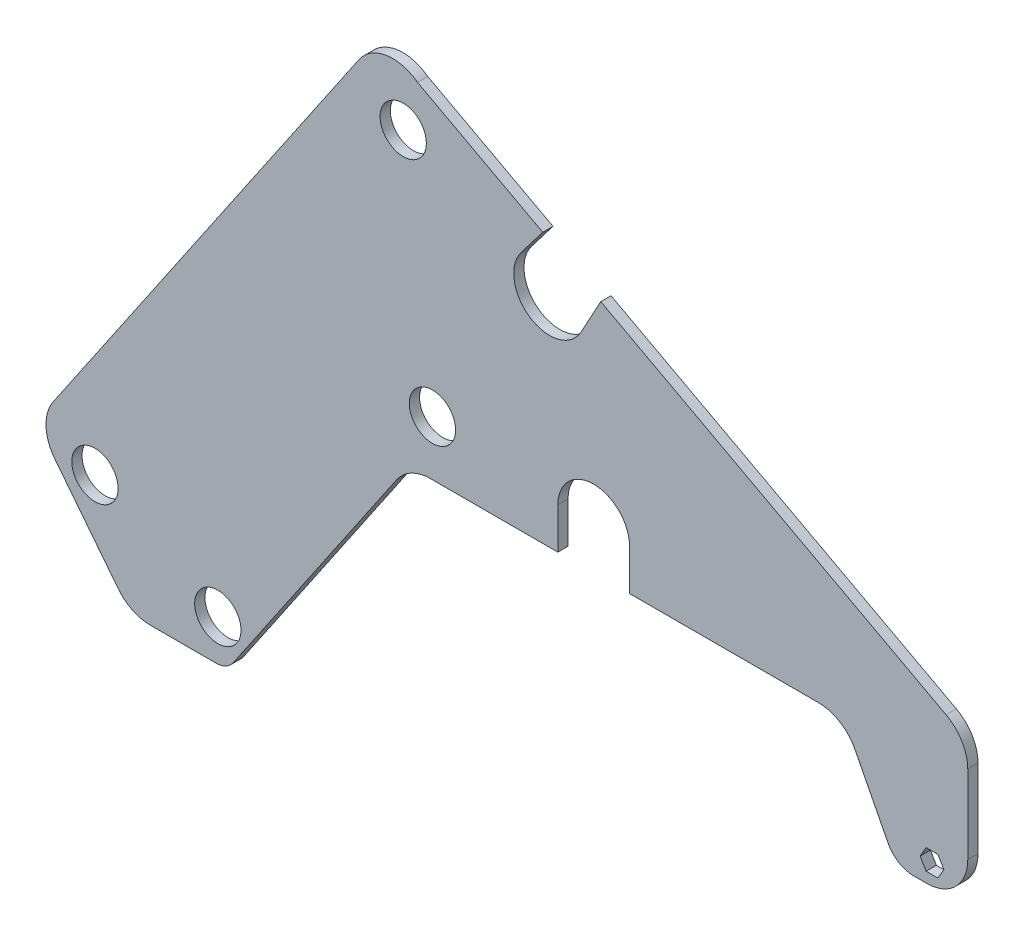
from build123d import *

# Parameters (mm, degrees)
MODEL_R             = 14.351
BOSS_EXTRUDE1_DEPTH = 6.35


with BuildPart() as part:
    # Model → Boss-Extrude1 (new body)
    with BuildSketch(Plane.XY):
        with BuildLine():
            ThreePointArc((-212.899365952, 93.541257838), (-203.778989185, 101.701881024), (-191.901103209, 104.650248016))
            Line((-191.901103209, 104.650248016), (-112.960030528, 104.650248016))
            Line((-112.960030528, 104.650248016), (-112.960030528, 130.050248016))
            ThreePointArc((-112.960030528, 130.050248016), (-90.735030528, 152.275248016), (-68.510030528, 130.050248016))
            Line((-68.510030528, 130.050248016), (-68.510030528, 104.650248016))
            Line((-68.510030528, 104.650248016), (-11.396613492, 104.650248016))
            Line((-11.396613492, 104.650248016), (-2.138802982, 104.650248016))
            Line((-2.138802982, 104.650248016), (48.661197018, 104.650248016))
            ThreePointArc((48.661197018, 104.650248016), (61.901986038, 100.926075708), (71.260020742, 90.8456422))
            Line((71.260020742, 90.8456422), (91.800416921, 50.813472087))
            ThreePointArc((91.800416921, 50.813472087), (98.351041214, 43.757168632), (107.619593528, 41.150248016))
            Line((107.619593528, 41.150248016), (115.808590566, 41.150248016))
            ThreePointArc((115.808590566, 41.150248016), (133.769102808, 48.589735774), (141.208590566, 66.550248016))
            Line((141.208590566, 66.550248016), (141.208590566, 78.884578982))
            Line((141.208590566, 78.884578982), (141.208590566, 115.30333804))
            ThreePointArc((141.208590566, 115.30333804), (137.602779127, 128.348388632), (127.809114585, 137.689660276))
            Line((127.809114585, 137.689660276), (-86.332685344, 252.483586072))
            Line((-86.332685344, 252.483586072), (-98.553562845, 230.047096279))
            ThreePointArc((-98.553562845, 230.047096279), (-130.164906677, 222.031598599), (-135.737030877, 254.163773966))
            Line((-135.737030877, 254.163773966), (-122.300827258, 271.764848372))
            Line((-122.300827258, 271.764848372), (-199.949582693, 313.389629113))
            ThreePointArc((-199.949582693, 313.389629113), (-219.402189514, 318.224062751), (-236.303247901, 307.447705012))
            Line((-236.303247901, 307.447705012), (-425.920878295, 28.83612519))
            ThreePointArc((-425.920878295, 28.83612519), (-430.307847502, 13.679090678), (-424.898106806, -1.14372618))
            Line((-424.898106806, -1.14372618), (-385.58146606, -51.20282143))
            ThreePointArc((-385.58146606, -51.20282143), (-376.71145599, -58.357541068), (-365.605974805, -60.913979882))
            Line((-365.605974805, -60.913979882), (-324.737451002, -60.913979882))
            ThreePointArc((-324.737451002, -60.913979882), (-318.798508014, -59.439796386), (-314.23831963, -55.359484793))
            Line((-314.23831963, -55.359484793), (-212.899365952, 93.541257838))
        make_face()
        with Locations((-323.775189267, -35.513979882)):
            Circle(MODEL_R, mode=Mode.SUBTRACT)
        with Locations((-399.975189267, 2.586020118)):
            Circle(MODEL_R, mode=Mode.SUBTRACT)
        Polygon((122.716975548, 60.200248016), (126.383149757, 53.850248016), (122.716975548, 47.500248016), (115.384627129, 47.500248016), (114.742237203, 48.612900006), (111.71845292, 53.850248016), (115.384627129, 60.200248016), (121.352034814, 60.200248016), align=None, mode=Mode.SUBTRACT)
        with Locations((-190.707148919, 138.516914683)):
            Circle(MODEL_R, mode=Mode.SUBTRACT)
        with Locations((-208.832932893, 283.437784316)):
            Circle(MODEL_R, mode=Mode.SUBTRACT)
    extrude(amount=BOSS_EXTRUDE1_DEPTH)


solid = part.part
